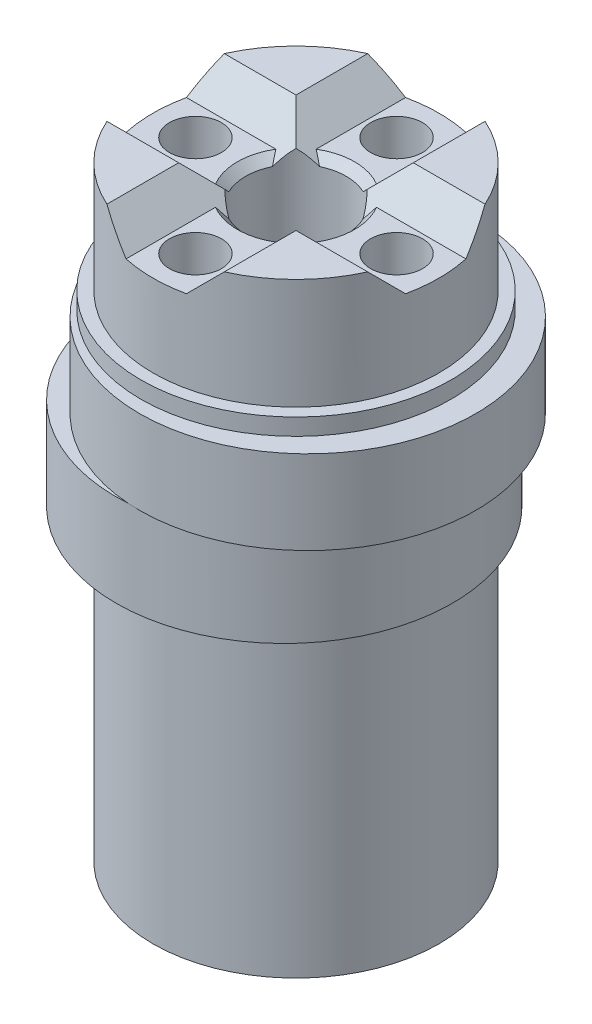
from build123d import *

# Parameters (mm, degrees)
SKETCH1_R            = 10.03
BOSS_EXTRUDE11_DEPTH = 5.5
SKETCH20_R           = 10.03
BOSS_EXTRUDE12_DEPTH = 5
SKETCH21_R           = 9.25
BOSS_EXTRUDE13_DEPTH = 1
SKETCH22_R           = 8.53
BOSS_EXTRUDE14_DEPTH = 6.6
BOSS_EXTRUDE15_START = 18
SKETCH30_R           = 8.53
BOSS_EXTRUDE15_DEPTH = 18
SKETCH31_R           = 1.55
CUT_EXTRUDE12_DEPTH  = 36.1
SKETCH33_R           = 2.1
CUT_EXTRUDE14_DEPTH  = 5.8
SKETCH36_R           = 3
CUT_EXTRUDE18_DEPTH  = 30.3
SKETCH37_W           = 9.5
SKETCH37_H           = 7
CUT_EXTRUDE19_DEPTH  = 1.7
CIRPATTERN1_COUNT    = 4
CHAMFER1_SIZE        = 1.7
CHAMFER2_SIZE        = 0.5


with BuildPart() as part:
    # Sketch1 → Boss-Extrude11 (new body)
    with BuildSketch(Plane(origin=(0, 0, 0), x_dir=(1, 0, 0), z_dir=(0, 1, 0))):
        with Locations(Location((0, 0, 0), (0, 0, 270))):
            Circle(SKETCH1_R)
    extrude(amount=BOSS_EXTRUDE11_DEPTH)

    # Sketch20 → Boss-Extrude12 (add)
    with BuildSketch(Plane(origin=(0, 5.5, 0), x_dir=(1, 0, 0), z_dir=(0, 1, 0))):
        with Locations(Location((1.4, 0, 0), (0, 0, 94.001961682))):
            Circle(SKETCH20_R)
    extrude(amount=BOSS_EXTRUDE12_DEPTH)

    # Sketch21 → Boss-Extrude13 (add)
    with BuildSketch(Plane(origin=(0, 10.5, 0), x_dir=(1, 0, 0), z_dir=(0, 1, 0))):
        with Locations(Location((0.7, 0, 0), (0, 0, 270))):
            Circle(SKETCH21_R)
    extrude(amount=BOSS_EXTRUDE13_DEPTH)

    # Sketch22 → Boss-Extrude14 (add)
    with BuildSketch(Plane(origin=(0, 11.5, 0), x_dir=(1, 0, 0), z_dir=(0, 1, 0))):
        with Locations(Location((0.7, 0, 0), (0, 0, 270))):
            Circle(SKETCH22_R)
    extrude(amount=BOSS_EXTRUDE14_DEPTH)

    # Sketch30 → Boss-Extrude15 (add)
    with BuildSketch(Plane.XZ.offset(BOSS_EXTRUDE15_START)):
        with Locations(Location((0.7, 0, 0), (0, 0, 90))):
            Circle(SKETCH30_R)
    extrude(amount=-BOSS_EXTRUDE15_DEPTH)

    # Sketch31 → Cut-Extrude12 (cut)
    with BuildSketch(Plane(origin=(0, 18.1, 0), x_dir=(1, 0, 0), z_dir=(0, 1, 0))):
        with Locations(Location((6.7, 0, 0), (0, 0, 270))):
            Circle(SKETCH31_R)
    cut_extrude12 = extrude(amount=-CUT_EXTRUDE12_DEPTH, mode=Mode.SUBTRACT)

    # Sketch33 → Cut-Extrude14 (cut)
    with BuildSketch(Plane.XZ.offset(18)):
        with Locations(Location((0.7, 0, 0), (0, 0, 270))):
            Circle(SKETCH33_R)
    extrude(amount=-CUT_EXTRUDE14_DEPTH, mode=Mode.SUBTRACT)

    # Sketch36 → Cut-Extrude18 (cut)
    with BuildSketch(Plane(origin=(0, 18.1, 0), x_dir=(1, 0, 0), z_dir=(0, 1, 0))):
        with Locations(Location((0.7, 0, 0), (0, 0, 270))):
            Circle(SKETCH36_R)
    extrude(amount=-CUT_EXTRUDE18_DEPTH, mode=Mode.SUBTRACT)

    # Sketch37 → Cut-Extrude19 (cut)
    with BuildSketch(Plane(origin=(0, 18.1, 0), x_dir=(1, 0, 0), z_dir=(0, 1, 0))):
        with Locations((5.45, 0)):
            Rectangle(SKETCH37_W, SKETCH37_H)
    cut_extrude19 = extrude(amount=-CUT_EXTRUDE19_DEPTH, mode=Mode.SUBTRACT)

    # CirPattern1: Cut-Extrude12, Cut-Extrude19 ×4 about axis
    cirpattern1_axis = Axis((0.7, 0, 0), (0, 1, 0))
    add([cut_extrude12.rotate(cirpattern1_axis, i * 360 / CIRPATTERN1_COUNT) for i in range(1, CIRPATTERN1_COUNT)], mode=Mode.SUBTRACT)
    add([cut_extrude19.rotate(cirpattern1_axis, i * 360 / CIRPATTERN1_COUNT) for i in range(1, CIRPATTERN1_COUNT)], mode=Mode.SUBTRACT)

    # Chamfer1
    # the kernel refuses this chamfer: 1.7 mm, written as the material it adds along each edge
    with BuildSketch(Plane(origin=(12.85073632, 16.4, -3.5), x_dir=(0, 0.9996219169112968, -0.027495876610586365), z_dir=(-1, 0, 0))) as chamfer1_piece_1_section:
        Polygon((CHAMFER1_SIZE * 0.999621916911, -CHAMFER1_SIZE * 0.0274958766106), (-CHAMFER1_SIZE * 0.0274958766106, -CHAMFER1_SIZE * 0.999621916911), (0, 0), align=None)
    chamfer1_piece_1 = extrude(amount=8.65073632, mode=Mode.PRIVATE)
    chamfer1_piece_1 = chamfer1_piece_1 & Plane(origin=(0.7, 16.951076754, 0), x_dir=(0, 0, 1), z_dir=(0, -1, 0)) * Cylinder(8.53, 25, mode=Mode.PRIVATE)
    chamfer1_piece_1 = split(chamfer1_piece_1, bisect_by=Plane(origin=(6.450066767, 18.1, -2.924017163), z_dir=(0, -1, 0)), keep=Keep.TOP, mode=Mode.PRIVATE)
    add(chamfer1_piece_1)
    with BuildSketch(Plane(origin=(4.2, 16.4, 3.5), x_dir=(0, 0.9996219169112968, 0.027495876610581792), z_dir=(1, 0, 0))) as chamfer1_piece_2_section:
        Polygon((CHAMFER1_SIZE * 0.999621916911, -CHAMFER1_SIZE * 0.0274958766106), (-CHAMFER1_SIZE * 0.0274958766106, -CHAMFER1_SIZE * 0.999621916911), (0, 0), align=None)
    chamfer1_piece_2 = extrude(amount=8.65073632, mode=Mode.PRIVATE)
    chamfer1_piece_2 = chamfer1_piece_2 & Plane(origin=(0.7, 16.951076754, 0), x_dir=(0, 0, 1), z_dir=(0, -1, 0)) * Cylinder(8.53, 25, mode=Mode.PRIVATE)
    chamfer1_piece_2 = split(chamfer1_piece_2, bisect_by=Plane(origin=(6.450066768, 18.1, 2.924017163), z_dir=(0, -1, 0)), keep=Keep.TOP, mode=Mode.PRIVATE)
    add(chamfer1_piece_2)
    with BuildSketch(Plane(origin=(-2.8, 16.4, -12.15073632), x_dir=(-0.027495876610586365, 0.9996219169112968, 0), z_dir=(0, 0, 1))) as chamfer1_piece_3_section:
        Polygon((CHAMFER1_SIZE * 0.999621916911, -CHAMFER1_SIZE * 0.0274958766106), (-CHAMFER1_SIZE * 0.0274958766106, -CHAMFER1_SIZE * 0.999621916911), (0, 0), align=None)
    chamfer1_piece_3 = extrude(amount=8.65073632, mode=Mode.PRIVATE)
    chamfer1_piece_3 = chamfer1_piece_3 & Plane(origin=(0.7, 16.951076754, 0), x_dir=(0, 0, 1), z_dir=(0, -1, 0)) * Cylinder(8.53, 25, mode=Mode.PRIVATE)
    chamfer1_piece_3 = split(chamfer1_piece_3, bisect_by=Plane(origin=(-2.224017163, 18.1, -5.750066767), z_dir=(0, -1, 0)), keep=Keep.TOP, mode=Mode.PRIVATE)
    add(chamfer1_piece_3)
    with BuildSketch(Plane(origin=(-2.8, 16.4, -3.5), x_dir=(0, 0.9996219169112968, -0.027495876610586365), z_dir=(-1, 0, 0))) as chamfer1_piece_4_section:
        Polygon((CHAMFER1_SIZE * 0.999621916911, -CHAMFER1_SIZE * 0.0274958766106), (-CHAMFER1_SIZE * 0.0274958766106, -CHAMFER1_SIZE * 0.999621916911), (0, 0), align=None)
    chamfer1_piece_4 = extrude(amount=8.65073632, mode=Mode.PRIVATE)
    chamfer1_piece_4 = chamfer1_piece_4 & Plane(origin=(0.7, 16.951076754, 0), x_dir=(0, 0, 1), z_dir=(0, -1, 0)) * Cylinder(8.53, 25, mode=Mode.PRIVATE)
    chamfer1_piece_4 = split(chamfer1_piece_4, bisect_by=Plane(origin=(-5.050066768, 18.1, -2.924017163), z_dir=(0, -1, 0)), keep=Keep.TOP, mode=Mode.PRIVATE)
    add(chamfer1_piece_4)
    with BuildSketch(Plane(origin=(-11.45073632, 16.4, 3.5), x_dir=(0, 0.9996219169112968, 0.027495876610586365), z_dir=(1, 0, 0))) as chamfer1_piece_5_section:
        Polygon((CHAMFER1_SIZE * 0.999621916911, -CHAMFER1_SIZE * 0.0274958766106), (-CHAMFER1_SIZE * 0.0274958766106, -CHAMFER1_SIZE * 0.999621916911), (0, 0), align=None)
    chamfer1_piece_5 = extrude(amount=8.65073632, mode=Mode.PRIVATE)
    chamfer1_piece_5 = chamfer1_piece_5 & Plane(origin=(0.7, 16.951076754, 0), x_dir=(0, 0, 1), z_dir=(0, -1, 0)) * Cylinder(8.53, 25, mode=Mode.PRIVATE)
    chamfer1_piece_5 = split(chamfer1_piece_5, bisect_by=Plane(origin=(-5.050066767, 18.1, 2.924017163), z_dir=(0, -1, 0)), keep=Keep.TOP, mode=Mode.PRIVATE)
    add(chamfer1_piece_5)
    with BuildSketch(Plane(origin=(-2.8, 16.4, 3.5), x_dir=(-0.027495876610586365, 0.9996219169112968, 0), z_dir=(0, 0, 1))) as chamfer1_piece_6_section:
        Polygon((CHAMFER1_SIZE * 0.999621916911, -CHAMFER1_SIZE * 0.0274958766106), (-CHAMFER1_SIZE * 0.0274958766106, -CHAMFER1_SIZE * 0.999621916911), (0, 0), align=None)
    chamfer1_piece_6 = extrude(amount=8.65073632, mode=Mode.PRIVATE)
    chamfer1_piece_6 = chamfer1_piece_6 & Plane(origin=(0.7, 16.951076754, 0), x_dir=(0, 0, 1), z_dir=(0, -1, 0)) * Cylinder(8.53, 25, mode=Mode.PRIVATE)
    chamfer1_piece_6 = split(chamfer1_piece_6, bisect_by=Plane(origin=(-2.224017163, 18.1, 5.750066768), z_dir=(0, -1, 0)), keep=Keep.TOP, mode=Mode.PRIVATE)
    add(chamfer1_piece_6)
    with BuildSketch(Plane(origin=(4.2, 16.4, 12.15073632), x_dir=(0.027495876610586365, 0.9996219169112968, 0), z_dir=(0, 0, -1))) as chamfer1_piece_7_section:
        Polygon((CHAMFER1_SIZE * 0.999621916911, -CHAMFER1_SIZE * 0.0274958766106), (-CHAMFER1_SIZE * 0.0274958766106, -CHAMFER1_SIZE * 0.999621916911), (0, 0), align=None)
    chamfer1_piece_7 = extrude(amount=8.65073632, mode=Mode.PRIVATE)
    chamfer1_piece_7 = chamfer1_piece_7 & Plane(origin=(0.7, 16.951076754, 0), x_dir=(0, 0, 1), z_dir=(0, -1, 0)) * Cylinder(8.53, 25, mode=Mode.PRIVATE)
    chamfer1_piece_7 = split(chamfer1_piece_7, bisect_by=Plane(origin=(3.624017163, 18.1, 5.750066767), z_dir=(0, -1, 0)), keep=Keep.TOP, mode=Mode.PRIVATE)
    add(chamfer1_piece_7)
    with BuildSketch(Plane(origin=(4.2, 16.4, -3.5), x_dir=(0.027495876610586365, 0.9996219169112968, 0), z_dir=(0, 0, -1))) as chamfer1_piece_8_section:
        Polygon((CHAMFER1_SIZE * 0.999621916911, -CHAMFER1_SIZE * 0.0274958766106), (-CHAMFER1_SIZE * 0.0274958766106, -CHAMFER1_SIZE * 0.999621916911), (0, 0), align=None)
    chamfer1_piece_8 = extrude(amount=8.65073632, mode=Mode.PRIVATE)
    chamfer1_piece_8 = chamfer1_piece_8 & Plane(origin=(0.7, 16.951076754, 0), x_dir=(0, 0, 1), z_dir=(0, -1, 0)) * Cylinder(8.53, 25, mode=Mode.PRIVATE)
    chamfer1_piece_8 = split(chamfer1_piece_8, bisect_by=Plane(origin=(3.624017163, 18.1, -5.750066768), z_dir=(0, -1, 0)), keep=Keep.TOP, mode=Mode.PRIVATE)
    add(chamfer1_piece_8)
    with BuildSketch(Plane(origin=(12.85073632, 16.4, -3.5), x_dir=(0, 0.9996219169112968, -0.027495876610586365), z_dir=(-1, 0, 0))) as chamfer1_piece_9a_section:
        Polygon((CHAMFER1_SIZE * 0.999621916911, -CHAMFER1_SIZE * 0.0274958766106), (-CHAMFER1_SIZE * 0.0274958766106, -CHAMFER1_SIZE * 0.999621916911), (0, 0), align=None)
    chamfer1_piece_9a = extrude(amount=13.022597399, mode=Mode.PRIVATE)
    chamfer1_piece_9a = split(chamfer1_piece_9a, bisect_by=Plane(origin=(2.33024723, 18.1, -3.085534958), z_dir=(0, -1, 0)), keep=Keep.TOP, mode=Mode.PRIVATE)
    chamfer1_piece_9a = split(chamfer1_piece_9a, bisect_by=Plane(origin=(4.2, 17.035605809, -3.085534958), z_dir=(-1, 0, 0)), keep=Keep.TOP, mode=Mode.PRIVATE)
    chamfer1_piece_9a = chamfer1_piece_9a - Plane(origin=(0.7, 17.035605809, 0), x_dir=(0, 0, 1), z_dir=(0, 1, 0)) * Cylinder(3, 33, mode=Mode.PRIVATE)
    with BuildSketch(Plane(origin=(4.2, 16.4, 0.87186108), x_dir=(0.027495876610586365, 0.9996219169112968, 0), z_dir=(0, 0, -1))) as chamfer1_piece_9b_section:
        Polygon((CHAMFER1_SIZE * 0.999621916911, -CHAMFER1_SIZE * 0.0274958766106), (-CHAMFER1_SIZE * 0.0274958766106, -CHAMFER1_SIZE * 0.999621916911), (0, 0), align=None)
    chamfer1_piece_9b = extrude(amount=13.022597399, mode=Mode.PRIVATE)
    chamfer1_piece_9b = split(chamfer1_piece_9b, bisect_by=Plane(origin=(3.785535078, 17.035605902, -3.5), z_dir=(0, 0, 1)), keep=Keep.TOP, mode=Mode.PRIVATE)
    chamfer1_piece_9b = split(chamfer1_piece_9b, bisect_by=Plane(origin=(3.785535078, 18.1, -1.630247283), z_dir=(0, -1, 0)), keep=Keep.TOP, mode=Mode.PRIVATE)
    chamfer1_piece_9b = chamfer1_piece_9b - Plane(origin=(0.7, 17.035605902, 0), x_dir=(0, 0, 1), z_dir=(0, 1, 0)) * Cylinder(3, 33, mode=Mode.PRIVATE)
    chamfer1_piece_9 = chamfer1_piece_9a & chamfer1_piece_9b
    add(chamfer1_piece_9)
    with BuildSketch(Plane(origin=(4.2, 16.4, 12.15073632), x_dir=(0.027495876610586365, 0.9996219169112968, 0), z_dir=(0, 0, -1))) as chamfer1_piece_10a_section:
        Polygon((CHAMFER1_SIZE * 0.999621916911, -CHAMFER1_SIZE * 0.0274958766106), (-CHAMFER1_SIZE * 0.0274958766106, -CHAMFER1_SIZE * 0.999621916911), (0, 0), align=None)
    chamfer1_piece_10a = extrude(amount=13.022597399, mode=Mode.PRIVATE)
    chamfer1_piece_10a = split(chamfer1_piece_10a, bisect_by=Plane(origin=(3.785534958, 18.1, 1.63024723), z_dir=(0, -1, 0)), keep=Keep.TOP, mode=Mode.PRIVATE)
    chamfer1_piece_10a = split(chamfer1_piece_10a, bisect_by=Plane(origin=(3.785534958, 17.035605809, 3.5), z_dir=(0, 0, -1)), keep=Keep.TOP, mode=Mode.PRIVATE)
    chamfer1_piece_10a = chamfer1_piece_10a - Plane(origin=(0.7, 17.035605809, 0), x_dir=(0, 0, 1), z_dir=(0, 1, 0)) * Cylinder(3, 33, mode=Mode.PRIVATE)
    with BuildSketch(Plane(origin=(-0.17186108, 16.4, 3.5), x_dir=(0, 0.9996219169112968, 0.027495876610586365), z_dir=(1, 0, 0))) as chamfer1_piece_10b_section:
        Polygon((CHAMFER1_SIZE * 0.999621916911, -CHAMFER1_SIZE * 0.0274958766106), (-CHAMFER1_SIZE * 0.0274958766106, -CHAMFER1_SIZE * 0.999621916911), (0, 0), align=None)
    chamfer1_piece_10b = extrude(amount=13.022597399, mode=Mode.PRIVATE)
    chamfer1_piece_10b = split(chamfer1_piece_10b, bisect_by=Plane(origin=(4.2, 17.035605903, 3.08553508), z_dir=(-1, 0, 0)), keep=Keep.TOP, mode=Mode.PRIVATE)
    chamfer1_piece_10b = split(chamfer1_piece_10b, bisect_by=Plane(origin=(2.330247274, 18.1, 3.08553508), z_dir=(0, -1, 0)), keep=Keep.TOP, mode=Mode.PRIVATE)
    chamfer1_piece_10b = chamfer1_piece_10b - Plane(origin=(0.7, 17.035605903, 0), x_dir=(0, 0, 1), z_dir=(0, 1, 0)) * Cylinder(3, 33, mode=Mode.PRIVATE)
    chamfer1_piece_10 = chamfer1_piece_10a & chamfer1_piece_10b
    add(chamfer1_piece_10)
    with BuildSketch(Plane(origin=(-2.8, 16.4, -12.15073632), x_dir=(-0.027495876610586365, 0.9996219169112968, 0), z_dir=(0, 0, 1))) as chamfer1_piece_11a_section:
        Polygon((CHAMFER1_SIZE * 0.999621916911, -CHAMFER1_SIZE * 0.0274958766106), (-CHAMFER1_SIZE * 0.0274958766106, -CHAMFER1_SIZE * 0.999621916911), (0, 0), align=None)
    chamfer1_piece_11a = extrude(amount=13.022597399, mode=Mode.PRIVATE)
    chamfer1_piece_11a = split(chamfer1_piece_11a, bisect_by=Plane(origin=(-2.385534958, 18.1, -1.63024723), z_dir=(0, -1, 0)), keep=Keep.TOP, mode=Mode.PRIVATE)
    chamfer1_piece_11a = split(chamfer1_piece_11a, bisect_by=Plane(origin=(-2.385534958, 17.035605809, -3.5), z_dir=(0, 0, 1)), keep=Keep.TOP, mode=Mode.PRIVATE)
    chamfer1_piece_11a = chamfer1_piece_11a - Plane(origin=(0.7, 17.035605809, 0), x_dir=(0, 0, 1), z_dir=(0, 1, 0)) * Cylinder(3, 33, mode=Mode.PRIVATE)
    with BuildSketch(Plane(origin=(1.57186108, 16.4, -3.5), x_dir=(0, 0.9996219169112968, -0.027495876610586365), z_dir=(-1, 0, 0))) as chamfer1_piece_11b_section:
        Polygon((CHAMFER1_SIZE * 0.999621916911, -CHAMFER1_SIZE * 0.0274958766106), (-CHAMFER1_SIZE * 0.0274958766106, -CHAMFER1_SIZE * 0.999621916911), (0, 0), align=None)
    chamfer1_piece_11b = extrude(amount=13.022597399, mode=Mode.PRIVATE)
    chamfer1_piece_11b = split(chamfer1_piece_11b, bisect_by=Plane(origin=(-2.8, 17.035605902, -3.085535078), z_dir=(1, 0, 0)), keep=Keep.TOP, mode=Mode.PRIVATE)
    chamfer1_piece_11b = split(chamfer1_piece_11b, bisect_by=Plane(origin=(-0.930247283, 18.1, -3.085535078), z_dir=(0, -1, 0)), keep=Keep.TOP, mode=Mode.PRIVATE)
    chamfer1_piece_11b = chamfer1_piece_11b - Plane(origin=(0.7, 17.035605902, 0), x_dir=(0, 0, 1), z_dir=(0, 1, 0)) * Cylinder(3, 33, mode=Mode.PRIVATE)
    chamfer1_piece_11 = chamfer1_piece_11a & chamfer1_piece_11b
    add(chamfer1_piece_11)
    with BuildSketch(Plane(origin=(-11.45073632, 16.4, 3.5), x_dir=(0, 0.9996219169112968, 0.027495876610586365), z_dir=(1, 0, 0))) as chamfer1_piece_12a_section:
        Polygon((CHAMFER1_SIZE * 0.999621916911, -CHAMFER1_SIZE * 0.0274958766106), (-CHAMFER1_SIZE * 0.0274958766106, -CHAMFER1_SIZE * 0.999621916911), (0, 0), align=None)
    chamfer1_piece_12a = extrude(amount=13.022597399, mode=Mode.PRIVATE)
    chamfer1_piece_12a = split(chamfer1_piece_12a, bisect_by=Plane(origin=(-0.930247276, 18.1, 3.08553506), z_dir=(0, -1, 0)), keep=Keep.TOP, mode=Mode.PRIVATE)
    chamfer1_piece_12a = split(chamfer1_piece_12a, bisect_by=Plane(origin=(-2.8, 17.035605889, 3.08553506), z_dir=(1, 0, 0)), keep=Keep.TOP, mode=Mode.PRIVATE)
    chamfer1_piece_12a = chamfer1_piece_12a - Plane(origin=(0.7, 17.035605889, 0), x_dir=(0, 0, 1), z_dir=(0, 1, 0)) * Cylinder(3, 33, mode=Mode.PRIVATE)
    with BuildSketch(Plane(origin=(-2.8, 16.4, -0.87186108), x_dir=(-0.027495876610586365, 0.9996219169112968, 0), z_dir=(0, 0, 1))) as chamfer1_piece_12b_section:
        Polygon((CHAMFER1_SIZE * 0.999621916911, -CHAMFER1_SIZE * 0.0274958766106), (-CHAMFER1_SIZE * 0.0274958766106, -CHAMFER1_SIZE * 0.999621916911), (0, 0), align=None)
    chamfer1_piece_12b = extrude(amount=13.022597399, mode=Mode.PRIVATE)
    chamfer1_piece_12b = split(chamfer1_piece_12b, bisect_by=Plane(origin=(-2.385535078, 17.035605902, 3.5), z_dir=(0, 0, -1)), keep=Keep.TOP, mode=Mode.PRIVATE)
    chamfer1_piece_12b = split(chamfer1_piece_12b, bisect_by=Plane(origin=(-2.385535078, 18.1, 1.630247283), z_dir=(0, -1, 0)), keep=Keep.TOP, mode=Mode.PRIVATE)
    chamfer1_piece_12b = chamfer1_piece_12b - Plane(origin=(0.7, 17.035605902, 0), x_dir=(0, 0, 1), z_dir=(0, 1, 0)) * Cylinder(3, 33, mode=Mode.PRIVATE)
    chamfer1_piece_12 = chamfer1_piece_12a & chamfer1_piece_12b
    add(chamfer1_piece_12)

    # Chamfer2
    chamfer2_edges = [part.edges().sort_by_distance(p)[0] for p in [
        (-2.3, 16.4, 0),
        (1.648683298, 16.4, 2.846049894),
        (3.7, 16.4, 0),
        (0.7, 16.4, -3),
    ]]
    chamfer(chamfer2_edges, length=CHAMFER2_SIZE)


solid = part.part
